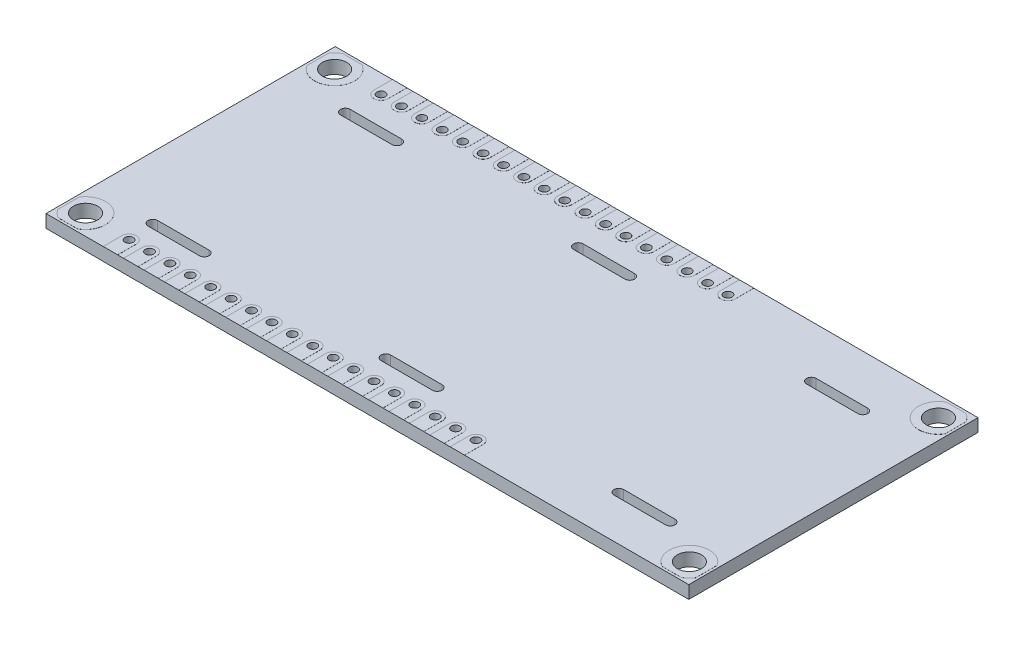
from build123d import *
from build123d.topology import SkipClean

# Parameters (mm, degrees)
ESQUISSE1_W        = 80
ESQUISSE1_H        = 36
ESQUISSE1_R        = 1.5
ESQUISSE1_R_2      = 0.52
BOSS_EXTRU_1_DEPTH = 1.6
ESQUISSE2_R        = 1.5
ESQUISSE2_R_2      = 0.52
BOSS_EXTRU_2_DEPTH = 0.01
BOSS_EXTRU_3_START = -1.61
ESQUISSE2_2_R      = 1.5
ESQUISSE2_2_R_2    = 0.52
BOSS_EXTRU_3_DEPTH = 0.01


with BuildPart() as part:
    # Esquisse1 → Boss.-Extru.1 (new body)
    with BuildSketch(Plane(origin=(0, 0, 0), x_dir=(1, 0, 0), z_dir=(0, 1, 0))):
        with Locations((40, 18)):
            Rectangle(ESQUISSE1_W, ESQUISSE1_H)
        with Locations(Location((2.42, 33.5, 0), (0, 0, 270))):
            Circle(ESQUISSE1_R, mode=Mode.SUBTRACT)
        with Locations(Location((2.42, 2.5, 0), (0, 0, 90))):
            Circle(ESQUISSE1_R, mode=Mode.SUBTRACT)
        with Locations(Location((77.58, 2.5, 0), (0, 0, 270))):
            Circle(ESQUISSE1_R, mode=Mode.SUBTRACT)
        with Locations(Location((77.58, 33.5, 0), (0, 0, 90))):
            Circle(ESQUISSE1_R, mode=Mode.SUBTRACT)
        with Locations(Location((8.02, 33.68, 0), (0, 0, 270))):
            Circle(ESQUISSE1_R_2, mode=Mode.SUBTRACT)
        with Locations(Location((10.56, 33.68, 0), (0, 0, 270))):
            Circle(ESQUISSE1_R_2, mode=Mode.SUBTRACT)
        with Locations(Location((13.1, 33.68, 0), (0, 0, 270))):
            Circle(ESQUISSE1_R_2, mode=Mode.SUBTRACT)
        with Locations(Location((15.64, 33.68, 0), (0, 0, 270))):
            Circle(ESQUISSE1_R_2, mode=Mode.SUBTRACT)
        with Locations(Location((18.18, 33.68, 0), (0, 0, 270))):
            Circle(ESQUISSE1_R_2, mode=Mode.SUBTRACT)
        with Locations(Location((20.72, 33.68, 0), (0, 0, 270))):
            Circle(ESQUISSE1_R_2, mode=Mode.SUBTRACT)
        with Locations(Location((23.26, 33.68, 0), (0, 0, 270))):
            Circle(ESQUISSE1_R_2, mode=Mode.SUBTRACT)
        with Locations(Location((25.8, 33.68, 0), (0, 0, 270))):
            Circle(ESQUISSE1_R_2, mode=Mode.SUBTRACT)
        with Locations(Location((28.34, 33.68, 0), (0, 0, 270))):
            Circle(ESQUISSE1_R_2, mode=Mode.SUBTRACT)
        with Locations(Location((30.88, 33.68, 0), (0, 0, 270))):
            Circle(ESQUISSE1_R_2, mode=Mode.SUBTRACT)
        with Locations(Location((33.42, 33.68, 0), (0, 0, 270))):
            Circle(ESQUISSE1_R_2, mode=Mode.SUBTRACT)
        with Locations(Location((35.96, 33.68, 0), (0, 0, 270))):
            Circle(ESQUISSE1_R_2, mode=Mode.SUBTRACT)
        with Locations(Location((38.5, 33.68, 0), (0, 0, 270))):
            Circle(ESQUISSE1_R_2, mode=Mode.SUBTRACT)
        with Locations(Location((41.04, 33.68, 0), (0, 0, 270))):
            Circle(ESQUISSE1_R_2, mode=Mode.SUBTRACT)
        with Locations(Location((43.58, 33.68, 0), (0, 0, 270))):
            Circle(ESQUISSE1_R_2, mode=Mode.SUBTRACT)
        with Locations(Location((46.12, 33.68, 0), (0, 0, 270))):
            Circle(ESQUISSE1_R_2, mode=Mode.SUBTRACT)
        with Locations(Location((48.66, 33.68, 0), (0, 0, 270))):
            Circle(ESQUISSE1_R_2, mode=Mode.SUBTRACT)
        with Locations(Location((51.2, 33.68, 0), (0, 0, 270))):
            Circle(ESQUISSE1_R_2, mode=Mode.SUBTRACT)
        with Locations(Location((51.2, 2.32, 0), (0, 0, 90))):
            Circle(ESQUISSE1_R_2, mode=Mode.SUBTRACT)
        with Locations(Location((48.66, 2.32, 0), (0, 0, 90))):
            Circle(ESQUISSE1_R_2, mode=Mode.SUBTRACT)
        with Locations(Location((46.12, 2.32, 0), (0, 0, 90))):
            Circle(ESQUISSE1_R_2, mode=Mode.SUBTRACT)
        with Locations(Location((41.04, 2.32, 0), (0, 0, 90))):
            Circle(ESQUISSE1_R_2, mode=Mode.SUBTRACT)
        with Locations(Location((43.58, 2.32, 0), (0, 0, 90))):
            Circle(ESQUISSE1_R_2, mode=Mode.SUBTRACT)
        with Locations(Location((38.5, 2.32, 0), (0, 0, 90))):
            Circle(ESQUISSE1_R_2, mode=Mode.SUBTRACT)
        with Locations(Location((35.96, 2.32, 0), (0, 0, 90))):
            Circle(ESQUISSE1_R_2, mode=Mode.SUBTRACT)
        with Locations(Location((33.42, 2.32, 0), (0, 0, 90))):
            Circle(ESQUISSE1_R_2, mode=Mode.SUBTRACT)
        with Locations(Location((30.88, 2.32, 0), (0, 0, 90))):
            Circle(ESQUISSE1_R_2, mode=Mode.SUBTRACT)
        with Locations(Location((28.34, 2.32, 0), (0, 0, 90))):
            Circle(ESQUISSE1_R_2, mode=Mode.SUBTRACT)
        with Locations(Location((25.8, 2.32, 0), (0, 0, 90))):
            Circle(ESQUISSE1_R_2, mode=Mode.SUBTRACT)
        with Locations(Location((23.26, 2.32, 0), (0, 0, 90))):
            Circle(ESQUISSE1_R_2, mode=Mode.SUBTRACT)
        with Locations(Location((20.72, 2.32, 0), (0, 0, 90))):
            Circle(ESQUISSE1_R_2, mode=Mode.SUBTRACT)
        with Locations(Location((18.18, 2.32, 0), (0, 0, 90))):
            Circle(ESQUISSE1_R_2, mode=Mode.SUBTRACT)
        with Locations(Location((15.64, 2.32, 0), (0, 0, 90))):
            Circle(ESQUISSE1_R_2, mode=Mode.SUBTRACT)
        with Locations(Location((13.1, 2.32, 0), (0, 0, 90))):
            Circle(ESQUISSE1_R_2, mode=Mode.SUBTRACT)
        with Locations(Location((10.56, 2.32, 0), (0, 0, 90))):
            Circle(ESQUISSE1_R_2, mode=Mode.SUBTRACT)
        with Locations(Location((8.02, 2.32, 0), (0, 0, 90))):
            Circle(ESQUISSE1_R_2, mode=Mode.SUBTRACT)
        with BuildLine():
            Line((7.7, 30.16), (14.1, 30.16))
            ThreePointArc((14.1, 30.16), (14.7, 29.56), (14.1, 28.96))
            Line((14.1, 28.96), (7.7, 28.96))
            ThreePointArc((7.7, 28.96), (7.1, 29.56), (7.7, 30.16))
        make_face(mode=Mode.SUBTRACT)
        with BuildLine():
            Line((7.7, 6.2), (14.1, 6.2))
            ThreePointArc((14.1, 6.2), (14.7, 5.6), (14.1, 5))
            Line((14.1, 5), (7.7, 5))
            ThreePointArc((7.7, 5), (7.1, 5.6), (7.7, 6.2))
        make_face(mode=Mode.SUBTRACT)
        with BuildLine():
            Line((36.7, 30.16), (43.1, 30.16))
            ThreePointArc((43.1, 30.16), (43.7, 29.56), (43.1, 28.96))
            Line((43.1, 28.96), (36.7, 28.96))
            ThreePointArc((36.7, 28.96), (36.1, 29.56), (36.7, 30.16))
        make_face(mode=Mode.SUBTRACT)
        with BuildLine():
            Line((36.7, 6.2), (43.1, 6.2))
            ThreePointArc((43.1, 6.2), (43.7, 5.6), (43.1, 5))
            Line((43.1, 5), (36.7, 5))
            ThreePointArc((36.7, 5), (36.1, 5.6), (36.7, 6.2))
        make_face(mode=Mode.SUBTRACT)
        with BuildLine():
            Line((65.7, 30.16), (72.1, 30.16))
            ThreePointArc((72.1, 30.16), (72.7, 29.56), (72.1, 28.96))
            Line((72.1, 28.96), (65.7, 28.96))
            ThreePointArc((65.7, 28.96), (65.1, 29.56), (65.7, 30.16))
        make_face(mode=Mode.SUBTRACT)
        with BuildLine():
            Line((65.7, 6.2), (72.1, 6.2))
            ThreePointArc((72.1, 6.2), (72.7, 5.6), (72.1, 5))
            Line((72.1, 5), (65.7, 5))
            ThreePointArc((65.7, 5), (65.1, 5.6), (65.7, 6.2))
        make_face(mode=Mode.SUBTRACT)
    extrude(amount=BOSS_EXTRU_1_DEPTH)

    # Esquisse2 → Boss.-Extru.2 (add)
    # profile 1 of 22: a face of its own
    with BuildSketch(Plane(origin=(0, 1.6, 0), x_dir=(1, 0, 0), z_dir=(0, 1, 0))):
        with BuildLine():
            Line((0.3, 32.175009434), (0.3, 34.824990566))
            ThreePointArc((0.3, 34.824990566), (0.709388811, 35.323131745), (1.232565791, 35.7))
            Line((1.232565791, 35.7), (3.607434209, 35.7))
            ThreePointArc((3.607434209, 35.7), (4.243131745, 31.789388811), (0.3, 32.175009434))
        make_face()
        with Locations(Location((2.42, 33.5, 0), (0, 0, 270))):
            Circle(ESQUISSE2_R, mode=Mode.SUBTRACT)
    # profile 2 of 22: a face of its own
    with BuildSketch(Plane(origin=(0, 1.6, 0), x_dir=(1, 0, 0), z_dir=(0, 1, 0))):
        with BuildLine():
            Line((7.12, 33.68), (7.12, 36))
            Line((7.12, 36), (8.92, 36))
            Line((8.92, 36), (8.92, 33.68))
            ThreePointArc((8.92, 33.68), (8.02, 32.78), (7.12, 33.68))
        make_face()
        with Locations(Location((8.02, 33.68, 0), (0, 0, 270))):
            Circle(ESQUISSE2_R_2, mode=Mode.SUBTRACT)
    # profile 3 of 22: a face of its own
    with BuildSketch(Plane(origin=(0, 1.6, 0), x_dir=(1, 0, 0), z_dir=(0, 1, 0))):
        with BuildLine():
            Line((3.607434209, 0.3), (1.232565791, 0.3))
            ThreePointArc((1.232565791, 0.3), (0.709388811, 0.676868255), (0.3, 1.175009434))
            Line((0.3, 1.175009434), (0.3, 3.824990566))
            ThreePointArc((0.3, 3.824990566), (4.243131745, 4.210611189), (3.607434209, 0.3))
        make_face()
        with Locations(Location((2.42, 2.5, 0), (0, 0, 90))):
            Circle(ESQUISSE2_R, mode=Mode.SUBTRACT)
    # profile 4 of 22: a face of its own
    with BuildSketch(Plane(origin=(0, 1.6, 0), x_dir=(1, 0, 0), z_dir=(0, 1, 0))):
        with BuildLine():
            Line((76.392565791, 0.3), (78.767434209, 0.3))
            ThreePointArc((78.767434209, 0.3), (79.290611189, 0.676868255), (79.7, 1.175009434))
            Line((79.7, 1.175009434), (79.7, 3.824990566))
            ThreePointArc((79.7, 3.824990566), (75.756868255, 4.210611189), (76.392565791, 0.3))
        make_face()
        with Locations(Location((77.58, 2.5, 0), (0, 0, 270))):
            Circle(ESQUISSE2_R, mode=Mode.SUBTRACT)
    # profile 5 of 22: a face of its own
    with BuildSketch(Plane(origin=(0, 1.6, 0), x_dir=(1, 0, 0), z_dir=(0, 1, 0))):
        with BuildLine():
            Line((79.7, 32.175009434), (79.7, 34.824990566))
            ThreePointArc((79.7, 34.824990566), (79.290611189, 35.323131745), (78.767434209, 35.7))
            Line((78.767434209, 35.7), (76.392565791, 35.7))
            ThreePointArc((76.392565791, 35.7), (75.756868255, 31.789388811), (79.7, 32.175009434))
        make_face()
        with Locations(Location((77.58, 33.5, 0), (0, 0, 90))):
            Circle(ESQUISSE2_R, mode=Mode.SUBTRACT)
    # profile 6 of 22: a face of its own
    with BuildSketch(Plane(origin=(0, 1.6, 0), x_dir=(1, 0, 0), z_dir=(0, 1, 0))):
        with BuildLine():
            Line((9.66, 33.68), (9.66, 36))
            Line((9.66, 36), (11.46, 36))
            Line((11.46, 36), (11.46, 33.68))
            ThreePointArc((11.46, 33.68), (10.56, 32.78), (9.66, 33.68))
        make_face()
        with Locations(Location((10.56, 33.68, 0), (0, 0, 270))):
            Circle(ESQUISSE2_R_2, mode=Mode.SUBTRACT)
    # profile 7 of 22: a face of its own
    with BuildSketch(Plane(origin=(0, 1.6, 0), x_dir=(1, 0, 0), z_dir=(0, 1, 0))):
        with BuildLine():
            Line((12.2, 33.68), (12.2, 36))
            Line((12.2, 36), (14, 36))
            Line((14, 36), (14, 33.68))
            ThreePointArc((14, 33.68), (13.1, 32.78), (12.2, 33.68))
        make_face()
        with Locations(Location((13.1, 33.68, 0), (0, 0, 270))):
            Circle(ESQUISSE2_R_2, mode=Mode.SUBTRACT)
    # profile 8 of 22: a face of its own
    with BuildSketch(Plane(origin=(0, 1.6, 0), x_dir=(1, 0, 0), z_dir=(0, 1, 0))):
        with BuildLine():
            Line((14.74, 33.68), (14.74, 36))
            Line((14.74, 36), (16.54, 36))
            Line((16.54, 36), (16.54, 33.68))
            ThreePointArc((16.54, 33.68), (15.64, 32.78), (14.74, 33.68))
        make_face()
        with Locations(Location((15.64, 33.68, 0), (0, 0, 270))):
            Circle(ESQUISSE2_R_2, mode=Mode.SUBTRACT)
    # profile 9 of 22: a face of its own
    with BuildSketch(Plane(origin=(0, 1.6, 0), x_dir=(1, 0, 0), z_dir=(0, 1, 0))):
        with BuildLine():
            Line((17.28, 33.68), (17.28, 36))
            Line((17.28, 36), (19.08, 36))
            Line((19.08, 36), (19.08, 33.68))
            ThreePointArc((19.08, 33.68), (18.18, 32.78), (17.28, 33.68))
        make_face()
        with Locations(Location((18.18, 33.68, 0), (0, 0, 270))):
            Circle(ESQUISSE2_R_2, mode=Mode.SUBTRACT)
    # profile 10 of 22: a face of its own
    with BuildSketch(Plane(origin=(0, 1.6, 0), x_dir=(1, 0, 0), z_dir=(0, 1, 0))):
        with BuildLine():
            Line((19.82, 33.68), (19.82, 36))
            Line((19.82, 36), (21.62, 36))
            Line((21.62, 36), (21.62, 33.68))
            ThreePointArc((21.62, 33.68), (20.72, 32.78), (19.82, 33.68))
        make_face()
        with Locations(Location((20.72, 33.68, 0), (0, 0, 270))):
            Circle(ESQUISSE2_R_2, mode=Mode.SUBTRACT)
    # profile 11 of 22: a face of its own
    with BuildSketch(Plane(origin=(0, 1.6, 0), x_dir=(1, 0, 0), z_dir=(0, 1, 0))):
        with BuildLine():
            Line((22.36, 33.68), (22.36, 36))
            Line((22.36, 36), (24.16, 36))
            Line((24.16, 36), (24.16, 33.68))
            ThreePointArc((24.16, 33.68), (23.26, 32.78), (22.36, 33.68))
        make_face()
        with Locations(Location((23.26, 33.68, 0), (0, 0, 270))):
            Circle(ESQUISSE2_R_2, mode=Mode.SUBTRACT)
    # profile 12 of 22: a face of its own
    with BuildSketch(Plane(origin=(0, 1.6, 0), x_dir=(1, 0, 0), z_dir=(0, 1, 0))):
        with BuildLine():
            Line((24.9, 33.68), (24.9, 36))
            Line((24.9, 36), (26.7, 36))
            Line((26.7, 36), (26.7, 33.68))
            ThreePointArc((26.7, 33.68), (25.8, 32.78), (24.9, 33.68))
        make_face()
        with Locations(Location((25.8, 33.68, 0), (0, 0, 270))):
            Circle(ESQUISSE2_R_2, mode=Mode.SUBTRACT)
    # profile 13 of 22: a face of its own
    with BuildSketch(Plane(origin=(0, 1.6, 0), x_dir=(1, 0, 0), z_dir=(0, 1, 0))):
        with BuildLine():
            Line((27.44, 33.68), (27.44, 36))
            Line((27.44, 36), (29.24, 36))
            Line((29.24, 36), (29.24, 33.68))
            ThreePointArc((29.24, 33.68), (28.34, 32.78), (27.44, 33.68))
        make_face()
        with Locations(Location((28.34, 33.68, 0), (0, 0, 270))):
            Circle(ESQUISSE2_R_2, mode=Mode.SUBTRACT)
    # profile 14 of 22: a face of its own
    with BuildSketch(Plane(origin=(0, 1.6, 0), x_dir=(1, 0, 0), z_dir=(0, 1, 0))):
        with BuildLine():
            Line((29.98, 33.68), (29.98, 36))
            Line((29.98, 36), (31.78, 36))
            Line((31.78, 36), (31.78, 33.68))
            ThreePointArc((31.78, 33.68), (30.88, 32.78), (29.98, 33.68))
        make_face()
        with Locations(Location((30.88, 33.68, 0), (0, 0, 270))):
            Circle(ESQUISSE2_R_2, mode=Mode.SUBTRACT)
    # profile 15 of 22: a face of its own
    with BuildSketch(Plane(origin=(0, 1.6, 0), x_dir=(1, 0, 0), z_dir=(0, 1, 0))):
        with BuildLine():
            Line((32.52, 33.68), (32.52, 36))
            Line((32.52, 36), (34.32, 36))
            Line((34.32, 36), (34.32, 33.68))
            ThreePointArc((34.32, 33.68), (33.42, 32.78), (32.52, 33.68))
        make_face()
        with Locations(Location((33.42, 33.68, 0), (0, 0, 270))):
            Circle(ESQUISSE2_R_2, mode=Mode.SUBTRACT)
    # profile 16 of 22: a face of its own
    with BuildSketch(Plane(origin=(0, 1.6, 0), x_dir=(1, 0, 0), z_dir=(0, 1, 0))):
        with BuildLine():
            Line((35.06, 33.68), (35.06, 36))
            Line((35.06, 36), (36.86, 36))
            Line((36.86, 36), (36.86, 33.68))
            ThreePointArc((36.86, 33.68), (35.96, 32.78), (35.06, 33.68))
        make_face()
        with Locations(Location((35.96, 33.68, 0), (0, 0, 270))):
            Circle(ESQUISSE2_R_2, mode=Mode.SUBTRACT)
    # profile 17 of 22: a face of its own
    with BuildSketch(Plane(origin=(0, 1.6, 0), x_dir=(1, 0, 0), z_dir=(0, 1, 0))):
        with BuildLine():
            Line((37.6, 33.68), (37.6, 36))
            Line((37.6, 36), (39.4, 36))
            Line((39.4, 36), (39.4, 33.68))
            ThreePointArc((39.4, 33.68), (38.5, 32.78), (37.6, 33.68))
        make_face()
        with Locations(Location((38.5, 33.68, 0), (0, 0, 270))):
            Circle(ESQUISSE2_R_2, mode=Mode.SUBTRACT)
    # profile 18 of 22: a face of its own
    with BuildSketch(Plane(origin=(0, 1.6, 0), x_dir=(1, 0, 0), z_dir=(0, 1, 0))):
        with BuildLine():
            Line((40.14, 33.68), (40.14, 36))
            Line((40.14, 36), (41.94, 36))
            Line((41.94, 36), (41.94, 33.68))
            ThreePointArc((41.94, 33.68), (41.04, 32.78), (40.14, 33.68))
        make_face()
        with Locations(Location((41.04, 33.68, 0), (0, 0, 270))):
            Circle(ESQUISSE2_R_2, mode=Mode.SUBTRACT)
    # profile 19 of 22: a face of its own
    with BuildSketch(Plane(origin=(0, 1.6, 0), x_dir=(1, 0, 0), z_dir=(0, 1, 0))):
        with BuildLine():
            Line((42.68, 33.68), (42.68, 36))
            Line((42.68, 36), (44.48, 36))
            Line((44.48, 36), (44.48, 33.68))
            ThreePointArc((44.48, 33.68), (43.58, 32.78), (42.68, 33.68))
        make_face()
        with Locations(Location((43.58, 33.68, 0), (0, 0, 270))):
            Circle(ESQUISSE2_R_2, mode=Mode.SUBTRACT)
    # profile 20 of 22: a face of its own
    with BuildSketch(Plane(origin=(0, 1.6, 0), x_dir=(1, 0, 0), z_dir=(0, 1, 0))):
        with BuildLine():
            Line((45.22, 33.68), (45.22, 36))
            Line((45.22, 36), (47.02, 36))
            Line((47.02, 36), (47.02, 33.68))
            ThreePointArc((47.02, 33.68), (46.12, 32.78), (45.22, 33.68))
        make_face()
        with Locations(Location((46.12, 33.68, 0), (0, 0, 270))):
            Circle(ESQUISSE2_R_2, mode=Mode.SUBTRACT)
    # profile 21 of 22: a face of its own
    with BuildSketch(Plane(origin=(0, 1.6, 0), x_dir=(1, 0, 0), z_dir=(0, 1, 0))):
        with BuildLine():
            Line((47.76, 33.68), (47.76, 36))
            Line((47.76, 36), (49.56, 36))
            Line((49.56, 36), (49.56, 33.68))
            ThreePointArc((49.56, 33.68), (48.66, 32.78), (47.76, 33.68))
        make_face()
        with Locations(Location((48.66, 33.68, 0), (0, 0, 270))):
            Circle(ESQUISSE2_R_2, mode=Mode.SUBTRACT)
    # profile 22 of 22: a face of its own
    with BuildSketch(Plane(origin=(0, 1.6, 0), x_dir=(1, 0, 0), z_dir=(0, 1, 0))):
        with BuildLine():
            Line((50.3, 33.68), (50.3, 36))
            Line((50.3, 36), (52.1, 36))
            Line((52.1, 36), (52.1, 33.68))
            ThreePointArc((52.1, 33.68), (51.2, 32.78), (50.3, 33.68))
        make_face()
        with Locations(Location((51.2, 33.68, 0), (0, 0, 270))):
            Circle(ESQUISSE2_R_2, mode=Mode.SUBTRACT)
    boss_extru_2 = extrude(amount=BOSS_EXTRU_2_DEPTH)

    # Esquisse2<2> → Boss.-Extru.3 (add)
    # profile 1 of 22: a face of its own
    with BuildSketch(Plane(origin=(0, 1.6, 0), x_dir=(1, 0, 0), z_dir=(0, 1, 0)).offset(BOSS_EXTRU_3_START)):
        with BuildLine():
            Line((0.3, 32.175009434), (0.3, 34.824990566))
            ThreePointArc((0.3, 34.824990566), (0.709388811, 35.323131745), (1.232565791, 35.7))
            Line((1.232565791, 35.7), (3.607434209, 35.7))
            ThreePointArc((3.607434209, 35.7), (4.243131745, 31.789388811), (0.3, 32.175009434))
        make_face()
        with Locations(Location((2.42, 33.5, 0), (0, 0, 90))):
            Circle(ESQUISSE2_2_R, mode=Mode.SUBTRACT)
    # profile 2 of 22: a face of its own
    with BuildSketch(Plane(origin=(0, 1.6, 0), x_dir=(1, 0, 0), z_dir=(0, 1, 0)).offset(BOSS_EXTRU_3_START)):
        with BuildLine():
            Line((7.12, 33.68), (7.12, 36))
            Line((7.12, 36), (8.92, 36))
            Line((8.92, 36), (8.92, 33.68))
            ThreePointArc((8.92, 33.68), (8.02, 32.78), (7.12, 33.68))
        make_face()
        with Locations(Location((8.02, 33.68, 0), (0, 0, 90))):
            Circle(ESQUISSE2_2_R_2, mode=Mode.SUBTRACT)
    # profile 3 of 22: a face of its own
    with BuildSketch(Plane(origin=(0, 1.6, 0), x_dir=(1, 0, 0), z_dir=(0, 1, 0)).offset(BOSS_EXTRU_3_START)):
        with BuildLine():
            Line((3.607434209, 0.3), (1.232565791, 0.3))
            ThreePointArc((1.232565791, 0.3), (0.709388811, 0.676868255), (0.3, 1.175009434))
            Line((0.3, 1.175009434), (0.3, 3.824990566))
            ThreePointArc((0.3, 3.824990566), (4.243131745, 4.210611189), (3.607434209, 0.3))
        make_face()
        with Locations(Location((2.42, 2.5, 0), (0, 0, 90))):
            Circle(ESQUISSE2_2_R, mode=Mode.SUBTRACT)
    # profile 4 of 22: a face of its own
    with BuildSketch(Plane(origin=(0, 1.6, 0), x_dir=(1, 0, 0), z_dir=(0, 1, 0)).offset(BOSS_EXTRU_3_START)):
        with BuildLine():
            Line((76.392565791, 0.3), (78.767434209, 0.3))
            ThreePointArc((78.767434209, 0.3), (79.290611189, 0.676868255), (79.7, 1.175009434))
            Line((79.7, 1.175009434), (79.7, 3.824990566))
            ThreePointArc((79.7, 3.824990566), (75.756868255, 4.210611189), (76.392565791, 0.3))
        make_face()
        with Locations(Location((77.58, 2.5, 0), (0, 0, 90))):
            Circle(ESQUISSE2_2_R, mode=Mode.SUBTRACT)
    # profile 5 of 22: a face of its own
    with BuildSketch(Plane(origin=(0, 1.6, 0), x_dir=(1, 0, 0), z_dir=(0, 1, 0)).offset(BOSS_EXTRU_3_START)):
        with BuildLine():
            Line((79.7, 32.175009434), (79.7, 34.824990566))
            ThreePointArc((79.7, 34.824990566), (79.290611189, 35.323131745), (78.767434209, 35.7))
            Line((78.767434209, 35.7), (76.392565791, 35.7))
            ThreePointArc((76.392565791, 35.7), (75.756868255, 31.789388811), (79.7, 32.175009434))
        make_face()
        with Locations(Location((77.58, 33.5, 0), (0, 0, 90))):
            Circle(ESQUISSE2_2_R, mode=Mode.SUBTRACT)
    # profile 6 of 22: a face of its own
    with BuildSketch(Plane(origin=(0, 1.6, 0), x_dir=(1, 0, 0), z_dir=(0, 1, 0)).offset(BOSS_EXTRU_3_START)):
        with BuildLine():
            Line((9.66, 33.68), (9.66, 36))
            Line((9.66, 36), (11.46, 36))
            Line((11.46, 36), (11.46, 33.68))
            ThreePointArc((11.46, 33.68), (10.56, 32.78), (9.66, 33.68))
        make_face()
        with Locations(Location((10.56, 33.68, 0), (0, 0, 90))):
            Circle(ESQUISSE2_2_R_2, mode=Mode.SUBTRACT)
    # profile 7 of 22: a face of its own
    with BuildSketch(Plane(origin=(0, 1.6, 0), x_dir=(1, 0, 0), z_dir=(0, 1, 0)).offset(BOSS_EXTRU_3_START)):
        with BuildLine():
            Line((12.2, 33.68), (12.2, 36))
            Line((12.2, 36), (14, 36))
            Line((14, 36), (14, 33.68))
            ThreePointArc((14, 33.68), (13.1, 32.78), (12.2, 33.68))
        make_face()
        with Locations(Location((13.1, 33.68, 0), (0, 0, 90))):
            Circle(ESQUISSE2_2_R_2, mode=Mode.SUBTRACT)
    # profile 8 of 22: a face of its own
    with BuildSketch(Plane(origin=(0, 1.6, 0), x_dir=(1, 0, 0), z_dir=(0, 1, 0)).offset(BOSS_EXTRU_3_START)):
        with BuildLine():
            Line((14.74, 33.68), (14.74, 36))
            Line((14.74, 36), (16.54, 36))
            Line((16.54, 36), (16.54, 33.68))
            ThreePointArc((16.54, 33.68), (15.64, 32.78), (14.74, 33.68))
        make_face()
        with Locations(Location((15.64, 33.68, 0), (0, 0, 90))):
            Circle(ESQUISSE2_2_R_2, mode=Mode.SUBTRACT)
    # profile 9 of 22: a face of its own
    with BuildSketch(Plane(origin=(0, 1.6, 0), x_dir=(1, 0, 0), z_dir=(0, 1, 0)).offset(BOSS_EXTRU_3_START)):
        with BuildLine():
            Line((17.28, 33.68), (17.28, 36))
            Line((17.28, 36), (19.08, 36))
            Line((19.08, 36), (19.08, 33.68))
            ThreePointArc((19.08, 33.68), (18.18, 32.78), (17.28, 33.68))
        make_face()
        with Locations(Location((18.18, 33.68, 0), (0, 0, 90))):
            Circle(ESQUISSE2_2_R_2, mode=Mode.SUBTRACT)
    # profile 10 of 22: a face of its own
    with BuildSketch(Plane(origin=(0, 1.6, 0), x_dir=(1, 0, 0), z_dir=(0, 1, 0)).offset(BOSS_EXTRU_3_START)):
        with BuildLine():
            Line((19.82, 33.68), (19.82, 36))
            Line((19.82, 36), (21.62, 36))
            Line((21.62, 36), (21.62, 33.68))
            ThreePointArc((21.62, 33.68), (20.72, 32.78), (19.82, 33.68))
        make_face()
        with Locations(Location((20.72, 33.68, 0), (0, 0, 90))):
            Circle(ESQUISSE2_2_R_2, mode=Mode.SUBTRACT)
    # profile 11 of 22: a face of its own
    with BuildSketch(Plane(origin=(0, 1.6, 0), x_dir=(1, 0, 0), z_dir=(0, 1, 0)).offset(BOSS_EXTRU_3_START)):
        with BuildLine():
            Line((22.36, 33.68), (22.36, 36))
            Line((22.36, 36), (24.16, 36))
            Line((24.16, 36), (24.16, 33.68))
            ThreePointArc((24.16, 33.68), (23.26, 32.78), (22.36, 33.68))
        make_face()
        with Locations(Location((23.26, 33.68, 0), (0, 0, 90))):
            Circle(ESQUISSE2_2_R_2, mode=Mode.SUBTRACT)
    # profile 12 of 22: a face of its own
    with BuildSketch(Plane(origin=(0, 1.6, 0), x_dir=(1, 0, 0), z_dir=(0, 1, 0)).offset(BOSS_EXTRU_3_START)):
        with BuildLine():
            Line((24.9, 33.68), (24.9, 36))
            Line((24.9, 36), (26.7, 36))
            Line((26.7, 36), (26.7, 33.68))
            ThreePointArc((26.7, 33.68), (25.8, 32.78), (24.9, 33.68))
        make_face()
        with Locations(Location((25.8, 33.68, 0), (0, 0, 90))):
            Circle(ESQUISSE2_2_R_2, mode=Mode.SUBTRACT)
    # profile 13 of 22: a face of its own
    with BuildSketch(Plane(origin=(0, 1.6, 0), x_dir=(1, 0, 0), z_dir=(0, 1, 0)).offset(BOSS_EXTRU_3_START)):
        with BuildLine():
            Line((27.44, 33.68), (27.44, 36))
            Line((27.44, 36), (29.24, 36))
            Line((29.24, 36), (29.24, 33.68))
            ThreePointArc((29.24, 33.68), (28.34, 32.78), (27.44, 33.68))
        make_face()
        with Locations(Location((28.34, 33.68, 0), (0, 0, 90))):
            Circle(ESQUISSE2_2_R_2, mode=Mode.SUBTRACT)
    # profile 14 of 22: a face of its own
    with BuildSketch(Plane(origin=(0, 1.6, 0), x_dir=(1, 0, 0), z_dir=(0, 1, 0)).offset(BOSS_EXTRU_3_START)):
        with BuildLine():
            Line((29.98, 33.68), (29.98, 36))
            Line((29.98, 36), (31.78, 36))
            Line((31.78, 36), (31.78, 33.68))
            ThreePointArc((31.78, 33.68), (30.88, 32.78), (29.98, 33.68))
        make_face()
        with Locations(Location((30.88, 33.68, 0), (0, 0, 90))):
            Circle(ESQUISSE2_2_R_2, mode=Mode.SUBTRACT)
    # profile 15 of 22: a face of its own
    with BuildSketch(Plane(origin=(0, 1.6, 0), x_dir=(1, 0, 0), z_dir=(0, 1, 0)).offset(BOSS_EXTRU_3_START)):
        with BuildLine():
            Line((32.52, 33.68), (32.52, 36))
            Line((32.52, 36), (34.32, 36))
            Line((34.32, 36), (34.32, 33.68))
            ThreePointArc((34.32, 33.68), (33.42, 32.78), (32.52, 33.68))
        make_face()
        with Locations(Location((33.42, 33.68, 0), (0, 0, 90))):
            Circle(ESQUISSE2_2_R_2, mode=Mode.SUBTRACT)
    # profile 16 of 22: a face of its own
    with BuildSketch(Plane(origin=(0, 1.6, 0), x_dir=(1, 0, 0), z_dir=(0, 1, 0)).offset(BOSS_EXTRU_3_START)):
        with BuildLine():
            Line((35.06, 33.68), (35.06, 36))
            Line((35.06, 36), (36.86, 36))
            Line((36.86, 36), (36.86, 33.68))
            ThreePointArc((36.86, 33.68), (35.96, 32.78), (35.06, 33.68))
        make_face()
        with Locations(Location((35.96, 33.68, 0), (0, 0, 90))):
            Circle(ESQUISSE2_2_R_2, mode=Mode.SUBTRACT)
    # profile 17 of 22: a face of its own
    with BuildSketch(Plane(origin=(0, 1.6, 0), x_dir=(1, 0, 0), z_dir=(0, 1, 0)).offset(BOSS_EXTRU_3_START)):
        with BuildLine():
            Line((37.6, 33.68), (37.6, 36))
            Line((37.6, 36), (39.4, 36))
            Line((39.4, 36), (39.4, 33.68))
            ThreePointArc((39.4, 33.68), (38.5, 32.78), (37.6, 33.68))
        make_face()
        with Locations(Location((38.5, 33.68, 0), (0, 0, 90))):
            Circle(ESQUISSE2_2_R_2, mode=Mode.SUBTRACT)
    # profile 18 of 22: a face of its own
    with BuildSketch(Plane(origin=(0, 1.6, 0), x_dir=(1, 0, 0), z_dir=(0, 1, 0)).offset(BOSS_EXTRU_3_START)):
        with BuildLine():
            Line((40.14, 33.68), (40.14, 36))
            Line((40.14, 36), (41.94, 36))
            Line((41.94, 36), (41.94, 33.68))
            ThreePointArc((41.94, 33.68), (41.04, 32.78), (40.14, 33.68))
        make_face()
        with Locations(Location((41.04, 33.68, 0), (0, 0, 90))):
            Circle(ESQUISSE2_2_R_2, mode=Mode.SUBTRACT)
    # profile 19 of 22: a face of its own
    with BuildSketch(Plane(origin=(0, 1.6, 0), x_dir=(1, 0, 0), z_dir=(0, 1, 0)).offset(BOSS_EXTRU_3_START)):
        with BuildLine():
            Line((42.68, 33.68), (42.68, 36))
            Line((42.68, 36), (44.48, 36))
            Line((44.48, 36), (44.48, 33.68))
            ThreePointArc((44.48, 33.68), (43.58, 32.78), (42.68, 33.68))
        make_face()
        with Locations(Location((43.58, 33.68, 0), (0, 0, 90))):
            Circle(ESQUISSE2_2_R_2, mode=Mode.SUBTRACT)
    # profile 20 of 22: a face of its own
    with BuildSketch(Plane(origin=(0, 1.6, 0), x_dir=(1, 0, 0), z_dir=(0, 1, 0)).offset(BOSS_EXTRU_3_START)):
        with BuildLine():
            Line((45.22, 33.68), (45.22, 36))
            Line((45.22, 36), (47.02, 36))
            Line((47.02, 36), (47.02, 33.68))
            ThreePointArc((47.02, 33.68), (46.12, 32.78), (45.22, 33.68))
        make_face()
        with Locations(Location((46.12, 33.68, 0), (0, 0, 90))):
            Circle(ESQUISSE2_2_R_2, mode=Mode.SUBTRACT)
    # profile 21 of 22: a face of its own
    with BuildSketch(Plane(origin=(0, 1.6, 0), x_dir=(1, 0, 0), z_dir=(0, 1, 0)).offset(BOSS_EXTRU_3_START)):
        with BuildLine():
            Line((47.76, 33.68), (47.76, 36))
            Line((47.76, 36), (49.56, 36))
            Line((49.56, 36), (49.56, 33.68))
            ThreePointArc((49.56, 33.68), (48.66, 32.78), (47.76, 33.68))
        make_face()
        with Locations(Location((48.66, 33.68, 0), (0, 0, 90))):
            Circle(ESQUISSE2_2_R_2, mode=Mode.SUBTRACT)
    # profile 22 of 22: a face of its own
    with BuildSketch(Plane(origin=(0, 1.6, 0), x_dir=(1, 0, 0), z_dir=(0, 1, 0)).offset(BOSS_EXTRU_3_START)):
        with BuildLine():
            Line((50.3, 33.68), (50.3, 36))
            Line((50.3, 36), (52.1, 36))
            Line((52.1, 36), (52.1, 33.68))
            ThreePointArc((52.1, 33.68), (51.2, 32.78), (50.3, 33.68))
        make_face()
        with Locations(Location((51.2, 33.68, 0), (0, 0, 90))):
            Circle(ESQUISSE2_2_R_2, mode=Mode.SUBTRACT)
    boss_extru_3 = extrude(amount=BOSS_EXTRU_3_DEPTH)

    # Esquisse3 → Révolution1 (revolve)
    with BuildSketch(Plane(origin=(0, 0, -18), x_dir=(-1, 0, 0), z_dir=(0, 0, -1))):
        with BuildLine():
            Line((-54, 0), (-54, -1.2))
            ThreePointArc((-54, -1.2), (-51.06347805, -0.894792675), (-48.25, 0))
            Line((-48.25, 0), (-54, 0))
        make_face()
    revolve(axis=Axis((54, -12.033839249, -18), (0, 1, 0)))

    # Esquisse3<6> → Révolution2 (revolve)
    with BuildSketch(Plane(origin=(0, 0, -18), x_dir=(-1, 0, 0), z_dir=(0, 0, -1))):
        with BuildLine():
            Line((-27.5, 0), (-27.5, -1.2))
            ThreePointArc((-27.5, -1.2), (-24.072081535, -0.897666363), (-20.75, 0))
            Line((-20.75, 0), (-27.5, 0))
        make_face()
    revolve(axis=Axis((27.5, 0, -18), (0, -1, 0)))

    # Mirror1: Boss.-Extru.2 across plane
    add(boss_extru_2.mirror(Plane(origin=(0, 0, -18), x_dir=(1, 0, 0), z_dir=(0, 0, -1))))

    # Mirror2: Boss.-Extru.3 across plane
    with SkipClean():  # the faces are left unmerged after this step: merging them gives an invalid solid
        add(boss_extru_3.mirror(Plane(origin=(0, 0, -18), x_dir=(1, 0, 0), z_dir=(0, 0, -1))))


solid = part.part
